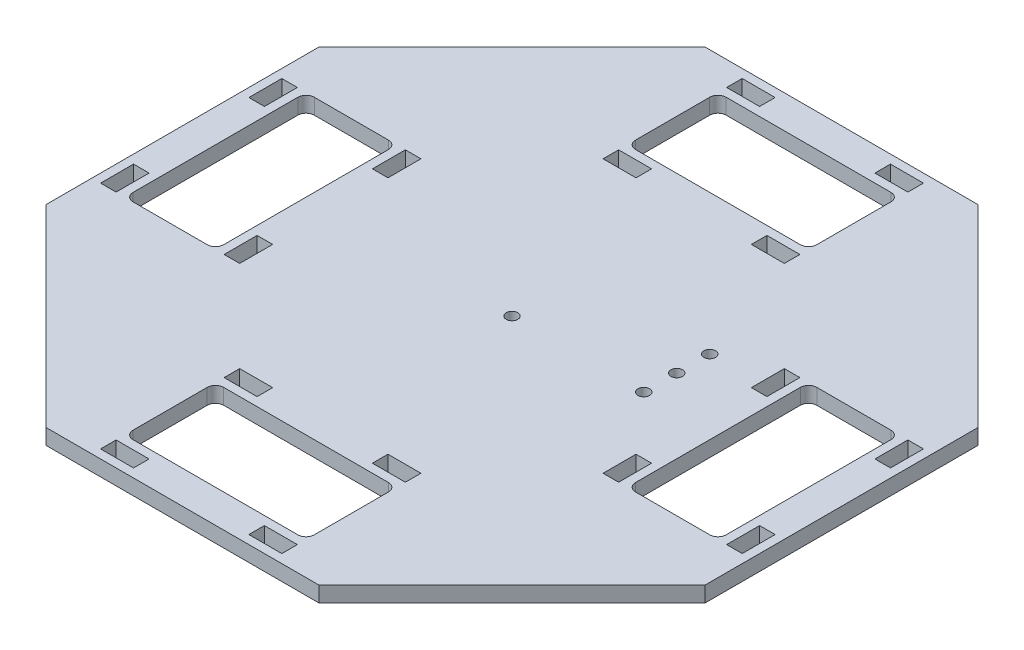
from build123d import *

# Parameters (mm, degrees)
BASE_DEPTH                                 = 5.9944
WHEEL_CUTOUT_REACH                         = 181.705
SKETCH3_W                                  = 69.85
SKETCH3_H                                  = 34.925
WHEEL_CUTOUT_FILLETS_R                     = 3.175
WHEEL_CUTOUT_PATTERN_COUNT                 = 4
WHEEL_CUTOUT_FILLETS_OF_WHEEL_CUTOUT_PAT_R = 3.175
SUPPORT_CUTOUTS_REACH                      = 181.705
SKETCH4_W                                  = 12.7
SKETCH4_H                                  = 5.9944
SUPPORT_CUTOUT_PATTERN_COUNT               = 4
F_8_CLEARANCE_HOLE1_D                      = 4.4958


with BuildPart() as part:
    # Base sketch → Base (new body)
    with BuildSketch(Plane(origin=(0, 0, 0), x_dir=(1, 0, 0), z_dir=(0, 1, 0))):
        Polygon((-127, 52.605122421), (-127, -52.605122421), (-52.605122421, -127), (52.605122421, -127), (127, -52.605122421), (127, 52.605122421), (52.605122421, 127), (-52.605122421, 127), align=None)
    extrude(amount=BASE_DEPTH)

    # Sketch3 → Wheel cutout (cut, up to next)
    with BuildSketch(Plane(origin=(0, 5.9944, 0), x_dir=(1, 0, 0), z_dir=(0, 1, 0)), mode=Mode.PRIVATE) as wheel_cutout_sk1:
        with Locations((0, 96.8375)):
            Rectangle(SKETCH3_W, SKETCH3_H)
    wheel_cutout_tool1 = extrude(wheel_cutout_sk1.sketch, amount=-WHEEL_CUTOUT_REACH, mode=Mode.PRIVATE) & part.part
    wheel_cutout = wheel_cutout_tool1.solids().sort_by_distance((0, 5.9944, -96.8375))[0]
    add(wheel_cutout, mode=Mode.SUBTRACT)

    # Wheel cutout fillets
    wheel_cutout_fillets_edges = [part.edges().sort_by_distance(p)[0] for p in [
        (34.925, 2.9972, -114.3),
        (34.925, 2.9972, -79.375),
        (-34.925, 2.9972, -79.375),
        (-34.925, 2.9972, -114.3),
    ]]
    fillet(wheel_cutout_fillets_edges, radius=WHEEL_CUTOUT_FILLETS_R)

    # Wheel cutout pattern: Wheel cutout ×4 about axis
    wheel_cutout_pattern_axis = Axis((0, -0.29972, 0), (0, 1, 0))
    for i in range(1, WHEEL_CUTOUT_PATTERN_COUNT):
        add(wheel_cutout.rotate(wheel_cutout_pattern_axis, i * 360 / WHEEL_CUTOUT_PATTERN_COUNT), mode=Mode.SUBTRACT)

    # Wheel cutout fillets of Wheel cutout pat
    wheel_cutout_fillets_of_wheel_cutout_pat_edges = [part.edges().sort_by_distance(p)[0] for p in [
        (-114.3, 2.9972, -34.925),
        (-79.375, 2.9972, -34.925),
        (-79.375, 2.9972, 34.925),
        (-114.3, 2.9972, 34.925),
        (-34.925, 2.9972, 114.3),
        (-34.925, 2.9972, 79.375),
        (34.925, 2.9972, 79.375),
        (34.925, 2.9972, 114.3),
        (114.3, 2.9972, 34.925),
        (79.375, 2.9972, 34.925),
        (79.375, 2.9972, -34.925),
        (114.3, 2.9972, -34.925),
    ]]
    fillet(wheel_cutout_fillets_of_wheel_cutout_pat_edges, radius=WHEEL_CUTOUT_FILLETS_OF_WHEEL_CUTOUT_PAT_R)

    # Sketch4 → Support cutouts (cut, up to next)
    with BuildSketch(Plane(origin=(0, 5.9944, 0), x_dir=(1, 0, 0), z_dir=(0, 1, 0)), mode=Mode.PRIVATE) as support_cutouts_sk1:
        with Locations((-28.575, 120.65)):
            Rectangle(SKETCH4_W, SKETCH4_H)
    support_cutouts_tool1 = extrude(support_cutouts_sk1.sketch, amount=-SUPPORT_CUTOUTS_REACH, mode=Mode.PRIVATE) & part.part
    # Sketch4 → Support cutouts (cut, up to next)
    with BuildSketch(Plane(origin=(0, 5.9944, 0), x_dir=(1, 0, 0), z_dir=(0, 1, 0)), mode=Mode.PRIVATE) as support_cutouts_sk2:
        with Locations((28.575, 120.65)):
            Rectangle(SKETCH4_W, SKETCH4_H)
    support_cutouts_tool2 = extrude(support_cutouts_sk2.sketch, amount=-SUPPORT_CUTOUTS_REACH, mode=Mode.PRIVATE) & part.part
    # Sketch4 → Support cutouts (cut, up to next)
    with BuildSketch(Plane(origin=(0, 5.9944, 0), x_dir=(1, 0, 0), z_dir=(0, 1, 0)), mode=Mode.PRIVATE) as support_cutouts_sk3:
        with Locations((28.575, 73.025)):
            Rectangle(SKETCH4_W, SKETCH4_H)
    support_cutouts_tool3 = extrude(support_cutouts_sk3.sketch, amount=-SUPPORT_CUTOUTS_REACH, mode=Mode.PRIVATE) & part.part
    # Sketch4 → Support cutouts (cut, up to next)
    with BuildSketch(Plane(origin=(0, 5.9944, 0), x_dir=(1, 0, 0), z_dir=(0, 1, 0)), mode=Mode.PRIVATE) as support_cutouts_sk4:
        with Locations((-28.575, 73.025)):
            Rectangle(SKETCH4_W, SKETCH4_H)
    support_cutouts_tool4 = extrude(support_cutouts_sk4.sketch, amount=-SUPPORT_CUTOUTS_REACH, mode=Mode.PRIVATE) & part.part
    support_cutouts_1 = support_cutouts_tool1.solids().sort_by_distance((-28.575, 5.9944, -120.65))[0]
    add(support_cutouts_1, mode=Mode.SUBTRACT)
    support_cutouts_2 = support_cutouts_tool2.solids().sort_by_distance((28.575, 5.9944, -120.65))[0]
    add(support_cutouts_2, mode=Mode.SUBTRACT)
    support_cutouts_3 = support_cutouts_tool3.solids().sort_by_distance((28.575, 5.9944, -73.025))[0]
    add(support_cutouts_3, mode=Mode.SUBTRACT)
    support_cutouts_4 = support_cutouts_tool4.solids().sort_by_distance((-28.575, 5.9944, -73.025))[0]
    add(support_cutouts_4, mode=Mode.SUBTRACT)
    support_cutouts = support_cutouts_1 + support_cutouts_2 + support_cutouts_3 + support_cutouts_4  # Support cutouts as one shape, for the pattern or mirror that repeats it

    # Support cutout pattern: Support cutouts ×4 about axis
    support_cutout_pattern_axis = Axis((0, -0.29972, 0), (0, 1, 0))
    for i in range(1, SUPPORT_CUTOUT_PATTERN_COUNT):
        add(support_cutouts.rotate(support_cutout_pattern_axis, i * 360 / SUPPORT_CUTOUT_PATTERN_COUNT), mode=Mode.SUBTRACT)

    # #8 Clearance Hole1 (through all)
    with Locations(Plane(origin=(0, 5.9944, 0), x_dir=(1, 0, 0), z_dir=(0, 1, 0))):
        with Locations((0, 0), (50.8, 0), (50.8, 12.7), (50.8, 25.4)):
            Hole(F_8_CLEARANCE_HOLE1_D / 2)


solid = part.part
